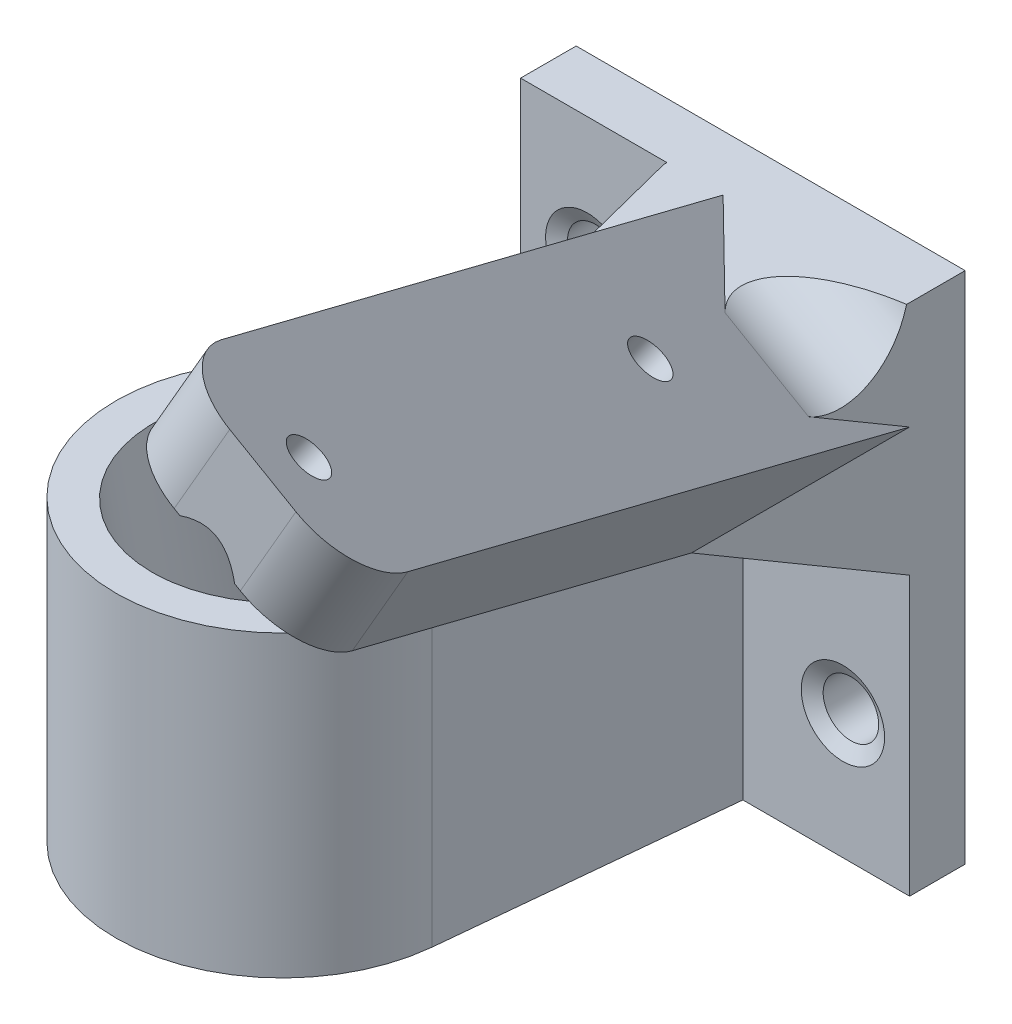
from build123d import *

# Parameters (mm, degrees)
SKETCH1_W                       = 28
SKETCH1_H                       = 37
BOSS_EXTRUDE1_DEPTH             = 4
EXTRUDE_THIN1_DEPTH             = 60
BOSS_EXTRUDE2_DEPTH             = 18.5
BOSS_EXTRUDE2_DEPTH_BACK        = 3
SKETCH5_R                       = 12
BOSS_EXTRUDE4_REACH             = 356.551
BOSS_EXTRUDE4_DIRECTION_2_DEPTH = 19
CUT_EXTRUDE2_DEPTH              = 363.265046463
CHAMFER1_START                  = 52.77449686
CHAMFER1_DEPTH                  = 8.045724116
FILLET1_R                       = 5
SKETCH12_R                      = 2
CUT_EXTRUDE3_DEPTH              = 11
CHAMFER3_SIZE                   = 1
CHAMFER3_SIZE2                  = 0.577350269
RIB2_START                      = -1.5
RIB2_DEPTH                      = 3
SKETCH13_R                      = 1.5
CUT_EXTRUDE6_DEPTH              = 11
FILLET2_R                       = 5
CUT_REVOLVE_START               = 202.331523811
CUT_REVOLVE_3_OUTLINE_R         = 9.25
CUT_REVOLVE_3_DEPTH             = 25.093721499


with BuildPart() as part:
    # Sketch1 → Boss-Extrude1 (new body)
    with BuildSketch(Plane.XY):
        with Locations((214.317546036, 222.190706617)):
            Rectangle(SKETCH1_W, SKETCH1_H)
    extrude(amount=BOSS_EXTRUDE1_DEPTH)

    # Sketch4 → Extrude-Thin1 (add, along a direction that is not the sketch's normal)
    with BuildSketch(Plane.XY.offset(4)):
        Polygon((214.894152277, 240.690706617), (228.317546036, 232.940706617), (224.317546036, 226.012503387), (210.894152277, 233.762503387), align=None)
    extrude(amount=EXTRUDE_THIN1_DEPTH, dir=(0.22699524986977232, 0.3931673058512374, 0.8910065241883693))

    # Sketch5 → Boss-Extrude2 (add, two sides: drawn at the far end of the back side and taken through both)
    with BuildSketch(Plane(origin=(0, 222.190706617, 0), x_dir=(-1, 0, 0), z_dir=(0, -1, 0)).offset(-BOSS_EXTRUDE2_DEPTH_BACK)):
        with BuildLine():
            Line((-191.578997844, -17.916678927), (-200.317546036, 0))
            Line((-200.317546036, 0), (-216.317546036, 0))
            Line((-216.317546036, 0), (-216.317546036, -4))
            Line((-216.317546036, -4), (-214.306389256, -24.35692569))
            ThreePointArc((-214.306389256, -24.35692569), (-205.636142491, -11.631721126), (-191.578997844, -17.916678927))
        make_face()
        with Locations((-202.3645264, -23.177132689)):
            Circle(SKETCH5_R)
    extrude(amount=BOSS_EXTRUDE2_DEPTH + BOSS_EXTRUDE2_DEPTH_BACK)

    # Boss-Extrude4: up to this face of the body (flat: up to its plane)
    boss_extrude4_end = Plane(part.part.faces().sort_by_distance((228.317546036, 222.190706617, 2))[0])
    # Sketch7 → Boss-Extrude4 (add, up to the picked face)
    with BuildSketch(Plane(origin=(70.371874774, -40.629220844, 0), x_dir=(0, 0, -1), z_dir=(0.8660254037844386, -0.5, 0)), mode=Mode.PRIVATE) as boss_extrude4_sk1:
        Polygon((-4, 315.891342524), (-19.700884044, 315.891342524), (-4, 307.891342524), align=None)
    boss_extrude4_tool1 = split(extrude(boss_extrude4_sk1.sketch, amount=BOSS_EXTRUDE4_REACH, mode=Mode.PRIVATE), bisect_by=boss_extrude4_end, keep=Keep.BOTH, mode=Mode.PRIVATE)
    add(boss_extrude4_tool1.solids().sort_by(Axis((226.984213, 230.631306, 9.233628), (0.8660254037844386, -0.5, 0)))[0])

    # Sketch7 → Boss-Extrude4 direction 2 (add)
    with BuildSketch(Plane(origin=(70.371874774, -40.629220844, 0), x_dir=(0, 0, -1), z_dir=(0.8660254037844386, -0.5, 0))):
        Polygon((-4, 315.891342524), (-19.700884044, 315.891342524), (-4, 307.891342524), align=None)
    extrude(amount=-BOSS_EXTRUDE4_DIRECTION_2_DEPTH)

    # Sketch8 → Cut-Extrude2 (cut, through all)
    with BuildSketch(Plane(origin=(0, 0, 4), x_dir=(-1, 0, 0), z_dir=(0, 0, -1))):
        Polygon((-214.894152277, 240.690706617), (-210.852700393, 240.690706617), (-211.863063364, 242.440706617), align=None)
    extrude(amount=-CUT_EXTRUDE2_DEPTH, mode=Mode.SUBTRACT)

    # Chamfer1: read off the stored shape, not the designer's step
    # Chamfer1 outline → Chamfer1 (cut)
    with BuildSketch(Plane(origin=(0, 0, 0), x_dir=(0.5316074109578968, 0.7735134037427047, 0.3450660441785277), z_dir=(0.8469908857919558, -0.48548982616312697, -0.21657808771308096)).offset(CHAMFER1_START)):
        Polygon((307.114108085, -80.169957731), (294.178723025, -92.183926772), (299.729695769, -94.190354162), align=None)
    extrude(amount=CHAMFER1_DEPTH, mode=Mode.SUBTRACT)

    # Fillet1
    # the kernel refuses this fillet: 5 mm, written as the material it adds along each edge
    with BuildSketch(Plane(origin=(197.228839574, 250.889779662, 4), x_dir=(0.49999999999999944, 0.8660254037844389, 0), z_dir=(0.866025403784439, -0.4999999999999995, 0))) as fillet1_piece_1_section:
        with BuildLine():
            CenterArc((FILLET1_R * 1.63185168713, FILLET1_R), FILLET1_R, 153, 117)
            Line((FILLET1_R * 0.74084516294, FILLET1_R * 1.45399049974), (0, 0))
            Line((0, 0), (FILLET1_R * 1.63185168713, 0))
        make_face()
    fillet1_piece_1 = extrude(amount=56.296292178, mode=Mode.PRIVATE)
    fillet1_piece_1 = split(fillet1_piece_1, bisect_by=Plane(origin=(228.317546036, 250.889779662, 4), z_dir=(-1, 0, 0)), keep=Keep.TOP, mode=Mode.PRIVATE)
    fillet1_piece_1 = split(fillet1_piece_1, bisect_by=Plane(origin=(197.228839574, 240.690706617, 4), z_dir=(0, -1, 0)), keep=Keep.TOP, mode=Mode.PRIVATE)
    add(fillet1_piece_1)

    # Sketch12 → Cut-Extrude3 (cut)
    with BuildSketch(Plane.XY.offset(4)):
        with Locations((205.117546036, 231.690706617)):
            Circle(SKETCH12_R)
        with Locations((223.517546036, 212.690706617)):
            Circle(SKETCH12_R)
    extrude(amount=-CUT_EXTRUDE3_DEPTH, mode=Mode.SUBTRACT)

    # Chamfer3
    chamfer3_edges = [part.edges().sort_by_distance(p)[0] for p in [
        (203.117546036, 231.690706617, 4),
        (221.517546036, 212.690706617, 4),
    ]]
    chamfer3_side = [part.faces().sort_by_distance(p)[0] for p in [
        (208.956042358, 238.333607157, 4),
    ]]
    chamfer(chamfer3_edges, length=CHAMFER3_SIZE, length2=CHAMFER3_SIZE2, reference=chamfer3_side[0])

    # Rib2: read off the stored shape, not the designer's step
    # Rib2 outline → Rib2 (add)
    with BuildSketch(Plane(origin=(63.660177895, -36.754220844, 0), x_dir=(-0.49999999999999845, -0.8660254037844396, 0), z_dir=(-0.8660254037844396, 0.49999999999999845, 0)).offset(RIB2_START)):
        Polygon((-301.043749716, 4), (-311.043749716, 20), (-316.043749716, 20), (-307.891342524, 4), align=None)
    extrude(amount=RIB2_DEPTH)

    # Sketch13 → Cut-Extrude6 (cut)
    with BuildSketch(Plane(origin=(124.582886752, 215.783889609, -126.956302744), x_dir=(0.8952803155791154, -0.38397537070557247, 0.2259116447376676), z_dir=(0.44550326209418484, 0.7716342848848018, -0.45399049973954403))):
        with Locations(Location((122.316663554, -176.73795859, 0), (0, 0, 270))):
            Circle(SKETCH13_R)
        with Locations(Location((112.935440602, -140.94700085, 0), (0, 0, 270))):
            Circle(SKETCH13_R)
    extrude(amount=-CUT_EXTRUDE6_DEPTH, mode=Mode.SUBTRACT)

    # Fillet2
    fillet2_edges = [part.edges().sort_by_distance(p)[0] for p in [
        (239.937261028, 253.066643353, 57.460391451),
        (226.51386727, 260.816643353, 57.460391451),
    ]]
    fillet(fillet2_edges, radius=FILLET2_R)

    # Chamfer4: read off the stored shape, not the designer's step
    # Chamfer4: loft between two sections, ruled curve by curve
    chamfer4_from = [
        Edge.make_three_point_arc((233.094750309, 254.144111481, 56.022204084), (231.428373697, 255.374841148, 56.47881494), (230.517297529, 254.821743623, 54.644687533)),
        Edge.make_three_point_arc((230.517297529, 254.821743623, 54.644687533), (232.183674141, 253.591013956, 54.188076677), (233.094750309, 254.144111481, 56.022204084)),
    ]
    chamfer4_to = [
        Edge.make_three_point_arc((233.195805822, 252.340022177, 57.460391452), (230.246651896, 254.518167985, 58.268501508), (228.634228967, 253.539295786, 55.022462165)),
        Edge.make_three_point_arc((228.634228967, 253.539295786, 55.022462165), (231.583382893, 251.361149979, 54.214352108), (233.195805822, 252.340022177, 57.460391452)),
    ]
    chamfer4 = Solid(Shell([*[Face.make_surface_from_curves(chamfer4_from[k], chamfer4_to[k]) for k in range(2)], Face(Wire(chamfer4_from)), Face(Wire(chamfer4_to))]))
    add(chamfer4, mode=Mode.SUBTRACT)

    # Chamfer4 2: loft between two sections, ruled curve by curve
    chamfer4_2_from = [
        Edge.make_three_point_arc((223.407199674, 240.696376934, 23.659041313), (222.064279201, 240.511700292, 22.027336946), (223.407199674, 239.175097537, 21.073367514)),
        Edge.make_three_point_arc((223.407199674, 239.175097537, 21.073367514), (224.750120147, 239.359774179, 22.705071881), (223.407199674, 240.696376934, 23.659041313)),
    ]
    chamfer4_2_to = [
        Edge.make_three_point_arc((222.51619315, 239.738649078, 25.562248622), (220.139492014, 239.411808289, 22.674457648), (222.51619315, 237.046288254, 20.986122204)),
        Edge.make_three_point_arc((222.51619315, 237.046288254, 20.986122204), (224.892894286, 237.373129042, 23.873913178), (222.51619315, 239.738649078, 25.562248622)),
    ]
    chamfer4_2 = Solid(Shell([*[Face.make_surface_from_curves(chamfer4_2_from[k], chamfer4_2_to[k]) for k in range(2)], Face(Wire(chamfer4_2_from)), Face(Wire(chamfer4_2_to))]))
    add(chamfer4_2, mode=Mode.SUBTRACT)

    # 切除-旋转3: read off the stored shape, not the designer's step
    # 切除-旋转3 outline → 切除-旋转3 (cut)
    with BuildSketch(Plane(origin=(0, 0, 0), x_dir=(1, 0, 0), z_dir=(0, 0.984807753012207, 0.173648177666937)).offset(CUT_REVOLVE_START)):
        with Locations((202.3645264, 16.278935867)):
            Circle(CUT_REVOLVE_3_OUTLINE_R)
    extrude(amount=CUT_REVOLVE_3_DEPTH, mode=Mode.SUBTRACT)


solid = part.part
